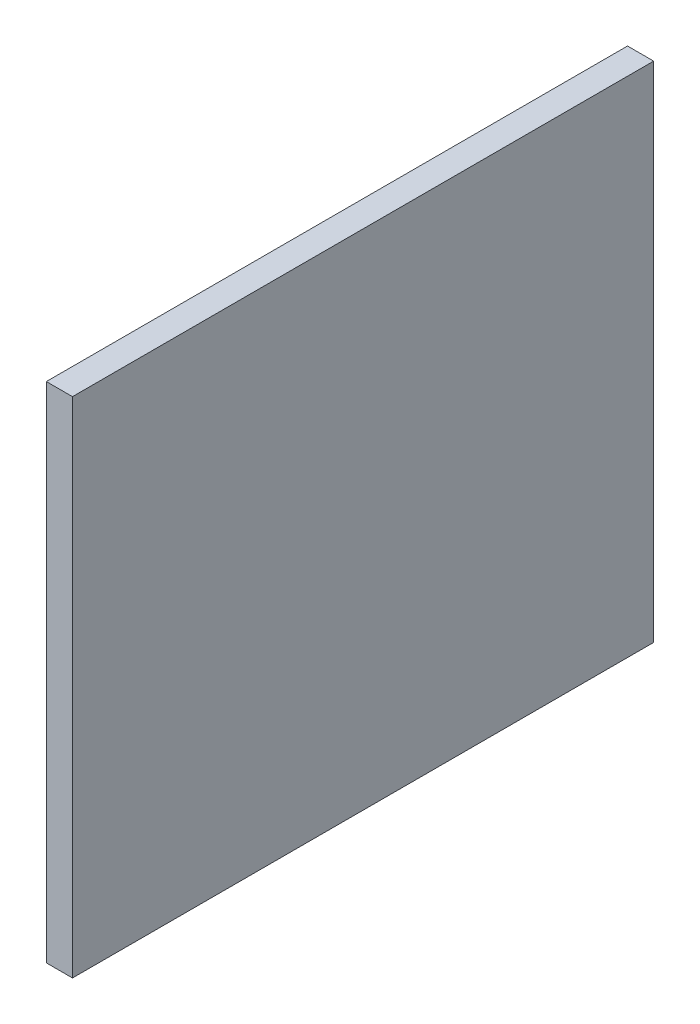
from build123d import *

# Parameters (mm, degrees)
SKETCH1_W           = 400
SKETCH1_H           = 346.5
BOSS_EXTRUDE1_DEPTH = 18


with BuildPart() as part:
    # Sketch1 → Boss-Extrude1 (new body)
    with BuildSketch(Plane(origin=(0, 0, 0), x_dir=(0, 0, -1), z_dir=(1, 0, 0))):
        Rectangle(SKETCH1_W, SKETCH1_H)
    extrude(amount=BOSS_EXTRUDE1_DEPTH)


solid = part.part
